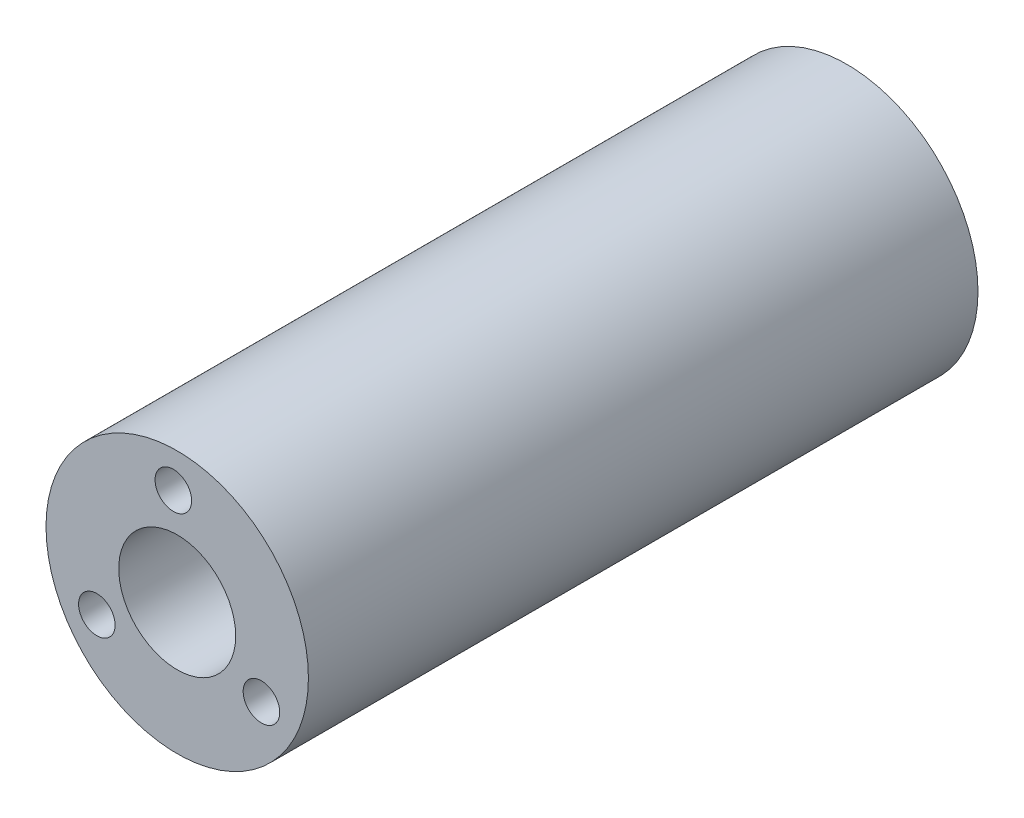
from build123d import *

# Parameters (mm, degrees)
SKETCH1_R           = 8.975
SKETCH1_R_2         = 1.25
SKETCH1_R_3         = 4
BOSS_EXTRUDE1_DEPTH = 45.8


with BuildPart() as part:
    # Sketch1 → Boss-Extrude1 (new body)
    with BuildSketch(Plane.XY):
        Circle(SKETCH1_R)
        with Locations((-0.265065705, 6.5)):
            Circle(SKETCH1_R_2, mode=Mode.SUBTRACT)
        with Locations((-5.496632272, -3.479553634)):
            Circle(SKETCH1_R_2, mode=Mode.SUBTRACT)
        with Locations((5.761697977, -3.020446366)):
            Circle(SKETCH1_R_2, mode=Mode.SUBTRACT)
        Circle(SKETCH1_R_3, mode=Mode.SUBTRACT)
    extrude(amount=BOSS_EXTRUDE1_DEPTH)


solid = part.part
